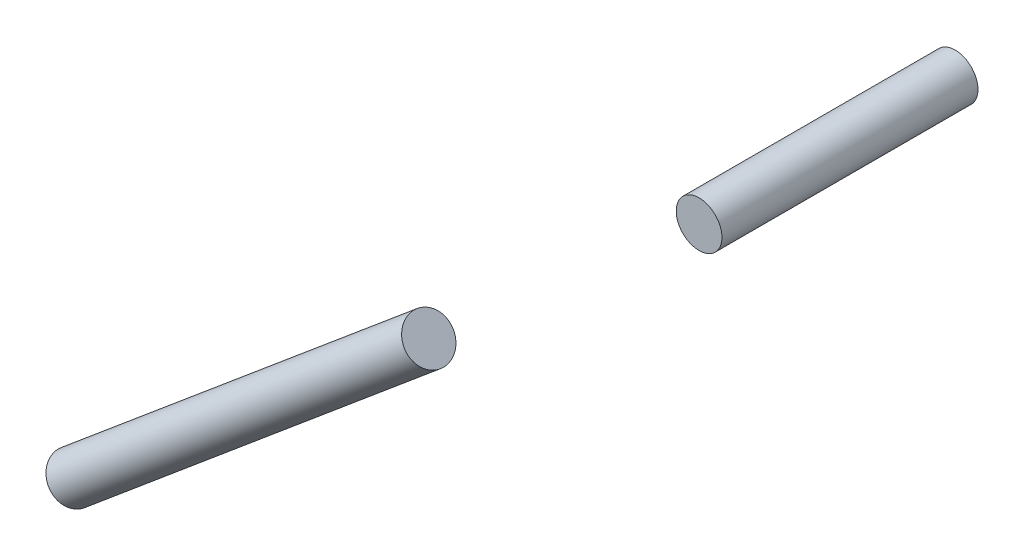
from build123d import *

# Parameters (mm, degrees)
BOSS_EXTRUDE1_OUTLINE_R = 6.35
BOSS_EXTRUDE1_DEPTH     = 128.9431
SKETCH3_R               = 6.35
BOSS_EXTRUDE2_DEPTH     = 71.1581


# Read off the part's stored shape, not the designer's step: Boss-Extrude1
with BuildPart() as part:
    # Boss-Extrude1 outline → Boss-Extrude1 (new body)
    with BuildSketch(Plane(origin=(-160.717192238, -134.723447429, 0), x_dir=(0, 0, -1), z_dir=(0.7663596576395588, 0.6424117644802112, 0))):
        with Locations((-61.5061, 0)):
            Circle(BOSS_EXTRUDE1_OUTLINE_R)
    extrude(amount=BOSS_EXTRUDE1_DEPTH)


with BuildPart() as body_2:
    # Sketch3 → Boss-Extrude2 (new body)
    with BuildSketch(Plane.XY.offset(48.2981)):
        Circle(SKETCH3_R)
    extrude(amount=-BOSS_EXTRUDE2_DEPTH)


solid = Compound([part.part, body_2.part])
